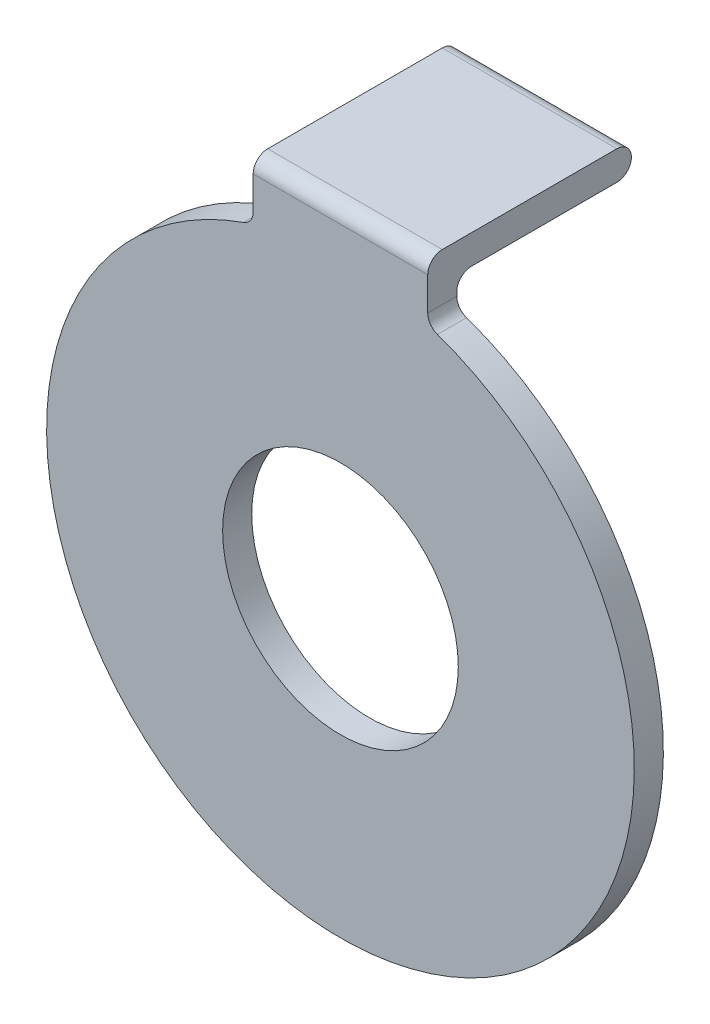
from build123d import *

# Parameters (mm, degrees)
SZKIC1_R                    = 4.05
DODANIE_WYCI_GNI_CIE3_DEPTH = 1
SZKIC5_W                    = 6
SZKIC5_H                    = 1
DODANIE_WYCI_GNI_CIE5_DEPTH = 6
ZAOKR_GLENIE3_R             = 0.5


with BuildPart() as part:
    # Szkic1 → Dodanie-wyciągnięcie3 (new body)
    with BuildSketch(Plane.XY):
        with BuildLine():
            Line((3, 11.644169223), (-3, 11.644169223))
            Line((-3, 11.644169223), (-3, 9.644169223))
            ThreePointArc((-3, 9.644169223), (0, -10.1), (3, 9.644169223))
            Line((3, 9.644169223), (3, 11.644169223))
        make_face()
        Circle(SZKIC1_R, mode=Mode.SUBTRACT)
    extrude(amount=DODANIE_WYCI_GNI_CIE3_DEPTH)

    # Szkic5 → Dodanie-wyciągnięcie5 (add)
    with BuildSketch(Plane(origin=(0, 0, 0), x_dir=(-1, 0, 0), z_dir=(0, 0, -1))):
        with Locations((0, 11.144169223)):
            Rectangle(SZKIC5_W, SZKIC5_H)
    extrude(amount=DODANIE_WYCI_GNI_CIE5_DEPTH)

    # Zaokrąglenie3
    zaokr_glenie3_edges = [part.edges().sort_by_distance(p)[0] for p in [
        (-3, 9.644169223, 0.5),
        (3, 9.644169223, 0.5),
        (0, 11.644169223, -6),
        (0, 10.644169223, -6),
        (0, 10.644169223, 0),
        (0, 11.644169223, 1),
    ]]
    fillet(zaokr_glenie3_edges, radius=ZAOKR_GLENIE3_R - 0.0001)  # a hair under: the kernel refuses the full size


solid = part.part
